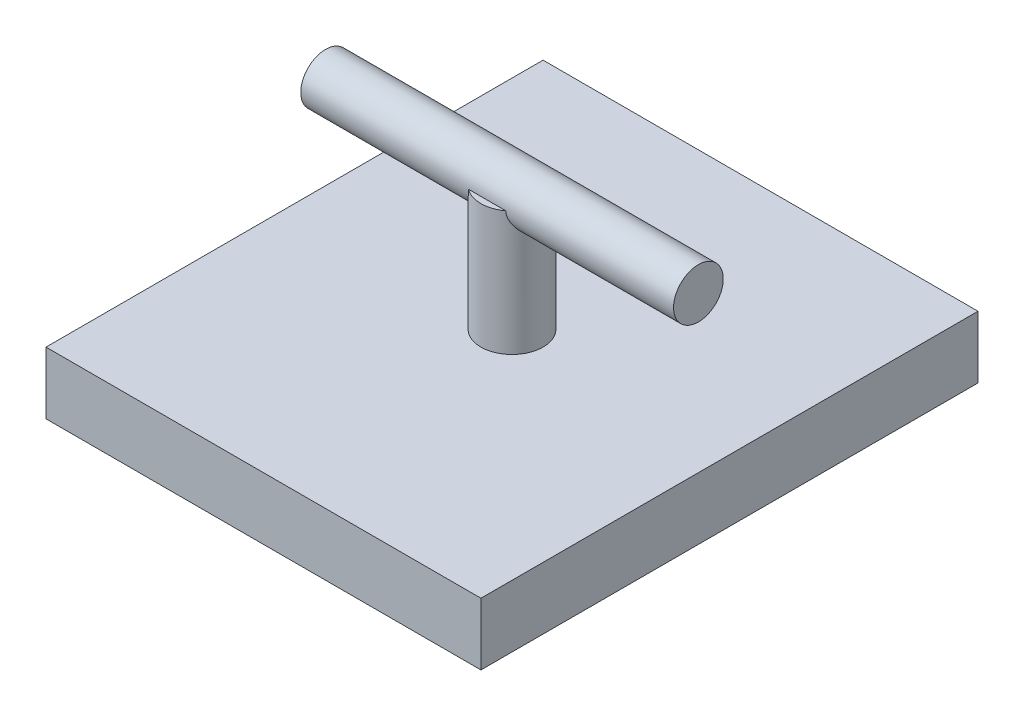
from build123d import *

# Parameters (mm, degrees)
SKETCH_1_W      = 60
SKETCH_1_H      = 4
SKETCH_3_R      = 5
EXTRUDE_2_DEPTH = 20
SKETCH_5_W      = 70
SKETCH_5_H      = 80
EXTRUDE_3_DEPTH = 10


with BuildPart() as part:
    # 草图1 → 旋转3 (revolve)
    with BuildSketch(Plane(origin=(0, 0, 0), x_dir=(1, 0, 0), z_dir=(0, 1, 0))):
        with Locations((0, 2)):
            Rectangle(SKETCH_1_W, SKETCH_1_H)
    revolve(axis=Axis((-30, 0, 0), (1, 0, 0)))

    # 草图3 → 凸台-拉伸2 (add)
    with BuildSketch(Plane(origin=(0, 0, 0), x_dir=(1, 0, 0), z_dir=(0, 1, 0))):
        Circle(SKETCH_3_R)
    extrude(amount=-EXTRUDE_2_DEPTH)

    # 草图5 → 凸台-拉伸3 (add)
    with BuildSketch(Plane.XZ.offset(20)):
        Rectangle(SKETCH_5_W, SKETCH_5_H)
    extrude(amount=EXTRUDE_3_DEPTH)


solid = part.part
